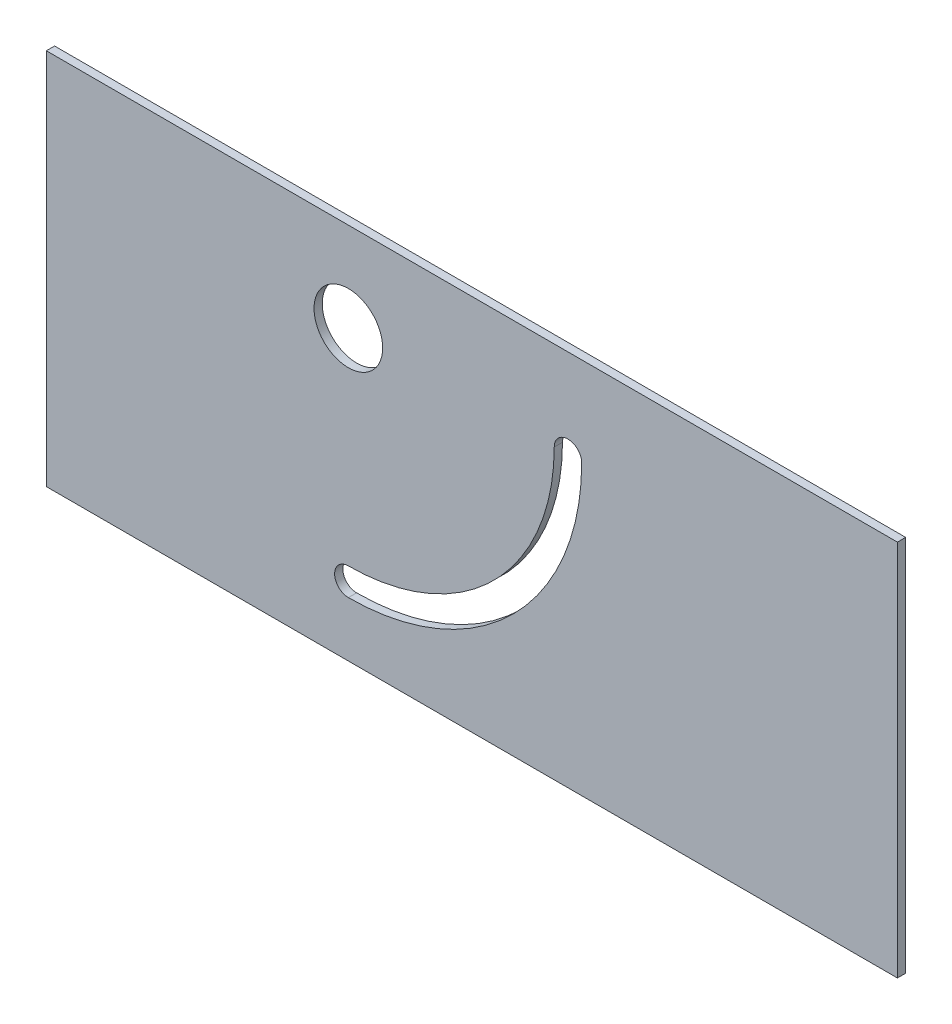
from build123d import *

# Parameters (mm, degrees)
SKETCH1_W           = 310
SKETCH1_H           = 137.5
SKETCH1_R           = 12.5
BOSS_EXTRUDE1_DEPTH = 3


with BuildPart() as part:
    # Sketch1 → Boss-Extrude1 (new body)
    with BuildSketch(Plane.XY.offset(32.5)):
        with Locations((129.5, 59.75)):
            Rectangle(SKETCH1_W, SKETCH1_H)
        with Locations((84.5, 96)):
            Circle(SKETCH1_R, mode=Mode.SUBTRACT)
        with BuildLine():
            ThreePointArc((169.5, 96), (164.5, 101), (159.5, 96))
            ThreePointArc((159.5, 96), (137.533008589, 42.966991411), (84.5, 21))
            ThreePointArc((84.5, 21), (79.5, 16), (84.5, 11))
            ThreePointArc((84.5, 11), (144.604076401, 35.895923599), (169.5, 96))
        make_face(mode=Mode.SUBTRACT)
    extrude(amount=BOSS_EXTRUDE1_DEPTH)


solid = part.part
